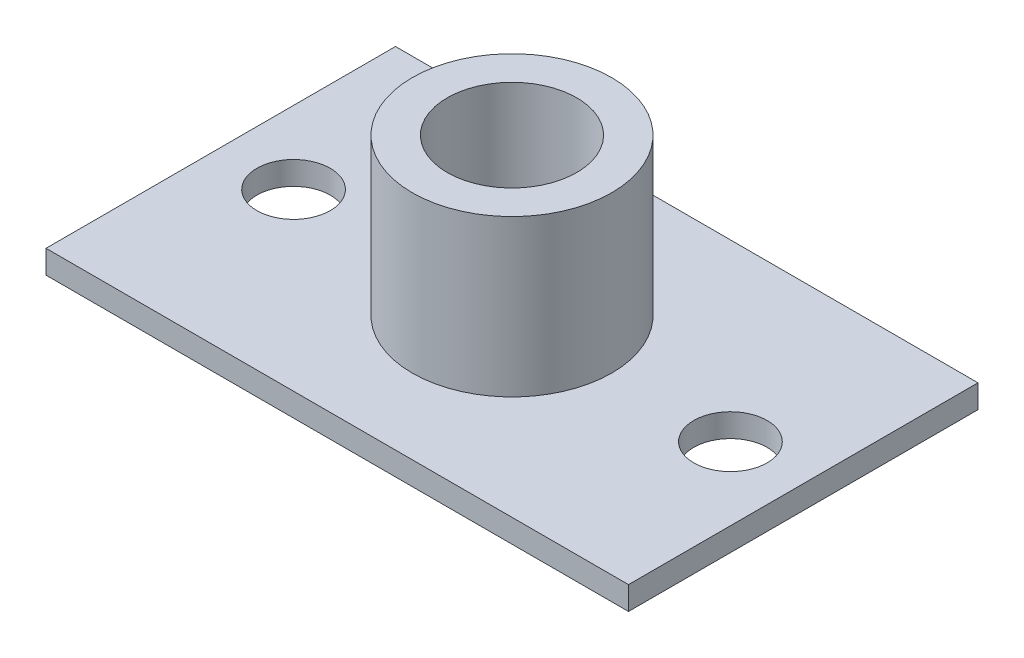
from build123d import *

# Parameters (mm, degrees)
SKETCH1_R           = 8.56
SKETCH1_R_2         = 5.56
BOSS_EXTRUDE1_DEPTH = 15.41
SKETCH1_3_W         = 50
SKETCH1_3_H         = 30
BOSS_EXTRUDE2_DEPTH = 2
SKETCH1_4_R         = 5.56
CUT_EXTRUDE1_DEPTH  = 2
SKETCH1_5_R         = 3.15
CUT_EXTRUDE2_DEPTH  = 2


with BuildPart() as part:
    # Sketch1 → Boss-Extrude1 (new body)
    with BuildSketch(Plane(origin=(0, 0, 0), x_dir=(1, 0, 0), z_dir=(0, 1, 0))):
        Circle(SKETCH1_R)
        Circle(SKETCH1_R_2, mode=Mode.SUBTRACT)
    extrude(amount=BOSS_EXTRUDE1_DEPTH)


with BuildPart() as body_2:
    # Sketch1<3> → Boss-Extrude2 (new body)
    with BuildSketch(Plane(origin=(0, 0, 0), x_dir=(1, 0, 0), z_dir=(0, 1, 0))):
        Rectangle(SKETCH1_3_W, SKETCH1_3_H)
    extrude(amount=BOSS_EXTRUDE2_DEPTH)

    # Sketch1<4> → Cut-Extrude1 (cut)
    with BuildSketch(Plane(origin=(0, 0, 0), x_dir=(1, 0, 0), z_dir=(0, 1, 0))):
        Circle(SKETCH1_4_R)
    extrude(amount=CUT_EXTRUDE1_DEPTH, mode=Mode.SUBTRACT)

    # Sketch1<5> → Cut-Extrude2 (cut)
    with BuildSketch(Plane(origin=(0, 0, 0), x_dir=(1, 0, 0), z_dir=(0, 1, 0))):
        with Locations((-18.75, 0)):
            Circle(SKETCH1_5_R)
        with Locations((18.75, 0)):
            Circle(SKETCH1_5_R)
    extrude(amount=CUT_EXTRUDE2_DEPTH, mode=Mode.SUBTRACT)


solid = Compound([part.part, body_2.part])
